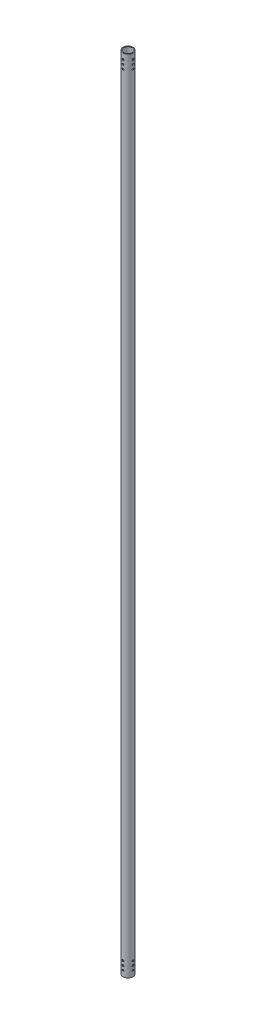
from build123d import *

# Parameters (mm, degrees)
EXTRUDE_1_OUTLINE_R                = 18
EXTRUDE_1_OUTLINE_R_2              = 15
EXTRUDE_1_DEPTH                    = 2880
SKETCH_2_R                         = 3
CUT_EXTRUDE_1_DEPTH                = 2881.112497803
PATTERN_LINEAR_1_COUNT             = 3
PATTERN_LINEAR_1_PITCH             = 15
PATTERN_CIRCULAR_1_COUNT           = 2
PATTERN_CIRCULAR_1_ANGLE           = 90
PATTERN_CIRCULAR_1_COPY_1_SKETCH_R = 3
PATTERN_CIRCULAR_1_COPY_1_DEPTH    = 2881.112497803
PATTERN_CIRCULAR_1_COPY_2_SKETCH_R = 3
PATTERN_CIRCULAR_1_COPY_2_DEPTH    = 2881.112497803


# Read off the part's stored shape, not the designer's step: Вытянуть-Тонкостенный1
with BuildPart() as part:
    # Вытянуть-Тонкостенный1 outline → Вытянуть-Тонкостенный1 (new body)
    with BuildSketch(Plane(origin=(0, 0, 0), x_dir=(1, 0, 0), z_dir=(0, 1, 0))):
        Circle(EXTRUDE_1_OUTLINE_R)
        Circle(EXTRUDE_1_OUTLINE_R_2, mode=Mode.SUBTRACT)
    extrude(amount=EXTRUDE_1_DEPTH)

    # Эскиз2 → Вырез-Вытянуть1 (cut, symmetric)
    with BuildSketch(Plane.XY):
        with Locations((0, 2830)):
            Circle(SKETCH_2_R)
        with Locations((0, 44)):
            Circle(SKETCH_2_R)
    cut_extrude_1 = extrude(amount=CUT_EXTRUDE_1_DEPTH, both=True, mode=Mode.SUBTRACT)

    # Линейный массив1: Вырез-Вытянуть1 ×3
    with Locations(*[(0, i * PATTERN_LINEAR_1_PITCH, 0) for i in range(1, PATTERN_LINEAR_1_COUNT)]):
        add(cut_extrude_1, mode=Mode.SUBTRACT)

    # Круговой массив1: Вырез-Вытянуть1 ×2 about axis
    pattern_circular_1_axis = Axis((0, 2880, 0), (0, -1, 0))
    for i in range(1, PATTERN_CIRCULAR_1_COUNT):
        add(cut_extrude_1.rotate(pattern_circular_1_axis, i * PATTERN_CIRCULAR_1_ANGLE / (PATTERN_CIRCULAR_1_COUNT - 1)), mode=Mode.SUBTRACT)

    # Круговой массив1 copy 1 sketch → Круговой массив1 copy 1 (cut, symmetric)
    with BuildSketch(Plane(origin=(0, 15, 0), x_dir=(0, 0, 1), z_dir=(-1, 0, 0))):
        with Locations((0, 2830)):
            Circle(PATTERN_CIRCULAR_1_COPY_1_SKETCH_R)
        with Locations((0, 44)):
            Circle(PATTERN_CIRCULAR_1_COPY_1_SKETCH_R)
    extrude(amount=PATTERN_CIRCULAR_1_COPY_1_DEPTH, both=True, mode=Mode.SUBTRACT)

    # Круговой массив1 copy 2 sketch → Круговой массив1 copy 2 (cut, symmetric)
    with BuildSketch(Plane(origin=(0, 30, 0), x_dir=(0, 0, 1), z_dir=(-1, 0, 0))):
        with Locations((0, 2830)):
            Circle(PATTERN_CIRCULAR_1_COPY_2_SKETCH_R)
        with Locations((0, 44)):
            Circle(PATTERN_CIRCULAR_1_COPY_2_SKETCH_R)
    extrude(amount=PATTERN_CIRCULAR_1_COPY_2_DEPTH, both=True, mode=Mode.SUBTRACT)

    # Surface Cut 1
    split(bisect_by=Plane(origin=(0, 24, 0), x_dir=(1, 0, 0), z_dir=(0, 1, 0)), keep=Keep.TOP)


solid = part.part
